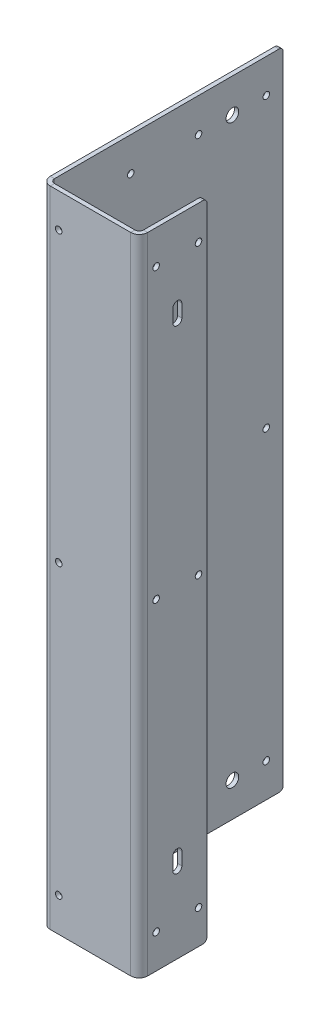
from build123d import *

# Parameters (mm, degrees)
BASE_FLANGE1_DEPTH = 482.6
SKETCH2_R          = 2.45745
CUT_EXTRUDE1_DEPTH = 3.175
SKETCH3_R          = 2.45745
SKETCH3_R_2        = 4.7625
CUT_EXTRUDE2_DEPTH = 3.175
SKETCH4_R          = 2.45745
CUT_EXTRUDE3_DEPTH = 3.175
FILLET1_R          = 3.175


# Sheet-metal steps are written as plain solids
with BuildPart() as part:
    # Sketch1 → Base-Flange1 (new body)
    with BuildSketch(Plane(origin=(0, 0, 0), x_dir=(1, 0, 0), z_dir=(0, 1, 0))):
        with BuildLine():
            Line((0, 177.8), (0, 6.35))
            ThreePointArc((0, 6.35), (1.859871939, 1.859871939), (6.35, 0))
            Line((6.35, 0), (66.675, 0))
            ThreePointArc((66.675, 0), (71.165128061, 1.859871939), (73.025, 6.35))
            Line((73.025, 6.35), (73.025, 50.8))
            Line((73.025, 50.8), (69.85, 50.8))
            Line((69.85, 50.8), (69.85, 6.35))
            ThreePointArc((69.85, 6.35), (68.92006403, 4.10493597), (66.675, 3.175))
            Line((66.675, 3.175), (6.35, 3.175))
            ThreePointArc((6.35, 3.175), (4.10493597, 4.10493597), (3.175, 6.35))
            Line((3.175, 6.35), (3.175, 177.8))
            Line((3.175, 177.8), (0, 177.8))
        make_face()
    extrude(amount=BASE_FLANGE1_DEPTH)

    # Sketch2 → Cut-Extrude1 (cut)
    with BuildSketch(Plane(origin=(73.025, 0, 0), x_dir=(0, 0, -1), z_dir=(1, 0, 0))):
        with Locations((12.7, 457.2)):
            Circle(SKETCH2_R)
        with Locations((44.45, 457.2)):
            Circle(SKETCH2_R)
        with Locations((12.7, 25.4)):
            Circle(SKETCH2_R)
        with Locations((44.45, 25.4)):
            Circle(SKETCH2_R)
        with Locations((44.45, 241.3)):
            Circle(SKETCH2_R)
        with Locations((12.7, 241.3)):
            Circle(SKETCH2_R)
        with BuildLine():
            Line((31.9484375, 423.8625), (31.9484375, 414.3375))
            ThreePointArc((31.9484375, 414.3375), (28.575, 410.9640625), (25.2015625, 414.3375))
            Line((25.2015625, 414.3375), (25.2015625, 423.8625))
            ThreePointArc((25.2015625, 423.8625), (28.575, 427.2359375), (31.9484375, 423.8625))
        make_face()
        with BuildLine():
            Line((31.9484375, 68.2625), (31.9484375, 58.7375))
            ThreePointArc((31.9484375, 58.7375), (28.575, 55.3640625), (25.2015625, 58.7375))
            Line((25.2015625, 58.7375), (25.2015625, 68.2625))
            ThreePointArc((25.2015625, 68.2625), (28.575, 71.6359375), (31.9484375, 68.2625))
        make_face()
    extrude(amount=-CUT_EXTRUDE1_DEPTH, mode=Mode.SUBTRACT)

    # Sketch3 → Cut-Extrude2 (cut)
    with BuildSketch(Plane.ZY):
        with Locations((-165.1, 457.2)):
            Circle(SKETCH3_R)
        with Locations((-165.1, 25.4)):
            Circle(SKETCH3_R)
        with Locations((-165.1, 241.3)):
            Circle(SKETCH3_R)
        with Locations((-114.3, 25.4)):
            Circle(SKETCH3_R)
        with Locations((-114.3, 241.3)):
            Circle(SKETCH3_R)
        with Locations((-114.3, 457.2)):
            Circle(SKETCH3_R)
        with Locations((-63.5, 25.4)):
            Circle(SKETCH3_R)
        with Locations((-63.5, 241.3)):
            Circle(SKETCH3_R)
        with Locations((-63.5, 457.2)):
            Circle(SKETCH3_R)
        with Locations((-139.7, 457.2)):
            Circle(SKETCH3_R_2)
        with Locations((-139.7, 25.4)):
            Circle(SKETCH3_R_2)
    extrude(amount=-CUT_EXTRUDE2_DEPTH, mode=Mode.SUBTRACT)

    # Sketch4 → Cut-Extrude3 (cut)
    with BuildSketch(Plane.XY):
        with Locations((12.7, 457.2)):
            Circle(SKETCH4_R)
        with Locations((12.7, 241.3)):
            Circle(SKETCH4_R)
        with Locations((12.7, 25.4)):
            Circle(SKETCH4_R)
    extrude(amount=-CUT_EXTRUDE3_DEPTH, mode=Mode.SUBTRACT)

    # Fillet1
    fillet1_edges = [part.edges().sort_by_distance(p)[0] for p in [
        (1.5875, 0, -177.8),
        (71.4375, 0, -50.8),
        (1.5875, 482.6, -177.8),
        (71.4375, 482.6, -50.8),
    ]]
    fillet(fillet1_edges, radius=FILLET1_R)


solid = part.part
